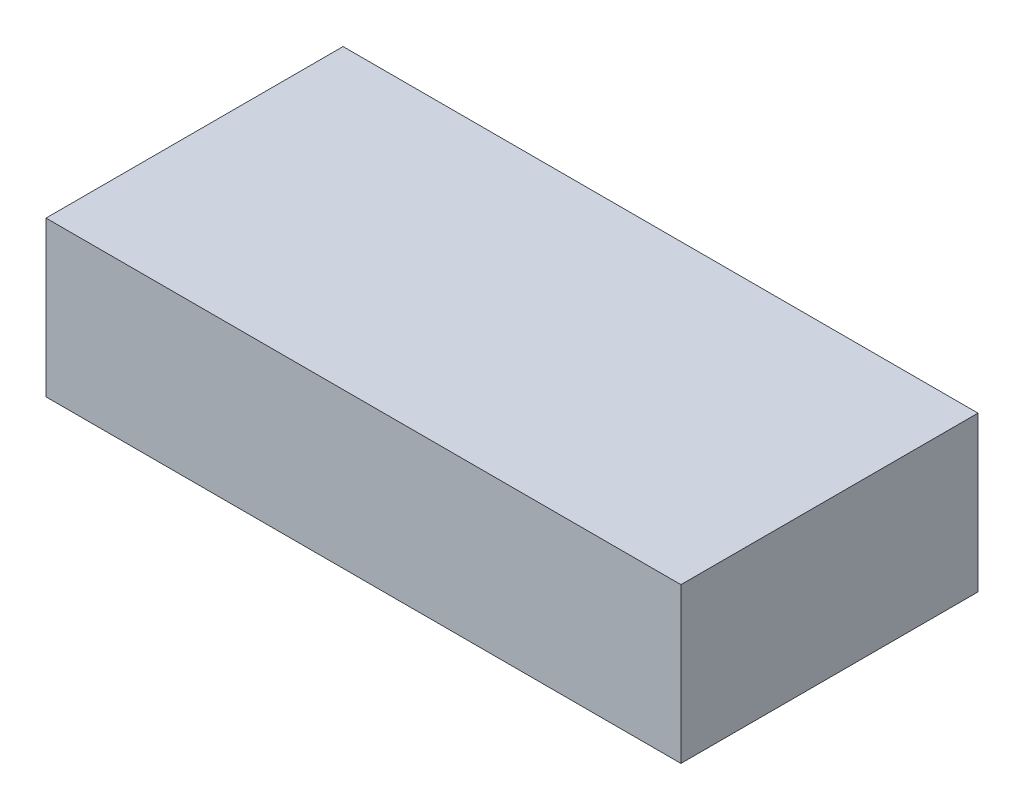
from build123d import *

# Parameters (mm, degrees)
SKETCH1_W           = 89.38
SKETCH1_H           = 41.82
BOSS_EXTRUDE6_DEPTH = 21.8
SKETCH1_13_R        = 2.2
CUT_EXTRUDE2_DEPTH  = 10


with BuildPart() as part:
    # Sketch1 → Boss-Extrude6 (new body)
    with BuildSketch(Plane(origin=(0, 0, 0), x_dir=(1, 0, 0), z_dir=(0, 1, 0))):
        Rectangle(SKETCH1_W, SKETCH1_H)
    extrude(amount=BOSS_EXTRUDE6_DEPTH)

    # Sketch1<13> → Cut-Extrude2 (cut)
    with BuildSketch(Plane(origin=(0, 0, 0), x_dir=(1, 0, 0), z_dir=(0, 1, 0))):
        with Locations((-25.39, 11.93)):
            Circle(SKETCH1_13_R)
        with Locations((-25.39, -12.11)):
            Circle(SKETCH1_13_R)
        with Locations((14.65, 11.93)):
            Circle(SKETCH1_13_R)
        with Locations((14.65, -12.11)):
            Circle(SKETCH1_13_R)
    extrude(amount=CUT_EXTRUDE2_DEPTH, mode=Mode.SUBTRACT)


solid = part.part
